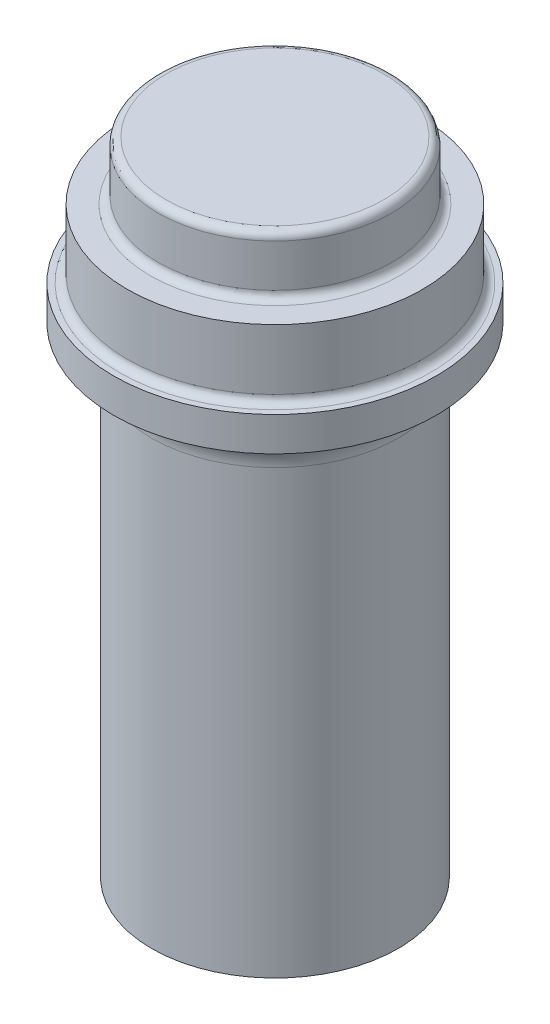
from build123d import *

# Parameters (mm, degrees)
SKETCH1_R           = 15.9
BOSS_EXTRUDE1_DEPTH = 62
SKETCH2_R           = 20.8
BOSS_EXTRUDE2_DEPTH = 4.4
SKETCH3_R           = 19.05
BOSS_EXTRUDE3_DEPTH = 8.8
SKETCH4_R           = 15.05
BOSS_EXTRUDE4_DEPTH = 7.5
FILLET1_R           = 5
FILLET2_R           = 1


with BuildPart() as part:
    # Sketch1 → Boss-Extrude1 (new body)
    with BuildSketch(Plane(origin=(0, 0, 0), x_dir=(1, 0, 0), z_dir=(0, 1, 0))):
        with Locations(Location((0, 0, 0), (0, 0, 270))):
            Circle(SKETCH1_R)
    extrude(amount=BOSS_EXTRUDE1_DEPTH)

    # Sketch2 → Boss-Extrude2 (add)
    with BuildSketch(Plane(origin=(0, 62, 0), x_dir=(1, 0, 0), z_dir=(0, 1, 0))):
        with Locations(Location((0, 0, 0), (0, 0, 270))):
            Circle(SKETCH2_R)
    extrude(amount=BOSS_EXTRUDE2_DEPTH)

    # Sketch3 → Boss-Extrude3 (add)
    with BuildSketch(Plane(origin=(0, 66.4, 0), x_dir=(1, 0, 0), z_dir=(0, 1, 0))):
        with Locations(Location((0, 0, 0), (0, 0, 270))):
            Circle(SKETCH3_R)
    extrude(amount=BOSS_EXTRUDE3_DEPTH)

    # Sketch4 → Boss-Extrude4 (add)
    with BuildSketch(Plane(origin=(0, 75.2, 0), x_dir=(1, 0, 0), z_dir=(0, 1, 0))):
        with Locations(Location((0, 0, 0), (0, 0, 270))):
            Circle(SKETCH4_R)
    extrude(amount=BOSS_EXTRUDE4_DEPTH)

    # Fillet1
    # the kernel refuses this fillet: 5 mm, written as the material it adds along each edge
    with BuildSketch(Plane(origin=(0, 62, 0), x_dir=(0, 0, 1), z_dir=(-1, 0, 0))) as fillet1_piece_1_section:
        with BuildLine():
            CenterArc((15.9 + FILLET1_R, -FILLET1_R), FILLET1_R, 90, 90)
            Line((15.9, -FILLET1_R), (15.9, 0))
            Line((15.9, 0), (15.9 + FILLET1_R, 0))
        make_face()
    fillet1_piece_1 = revolve(axis=Axis((0, 62, 0), (0, 1, 0)), mode=Mode.PRIVATE)
    fillet1_piece_1 = fillet1_piece_1 & Plane(origin=(0, 60.561583107, 0), x_dir=(0, 0, 1), z_dir=(0, -1, 0)) * Cylinder(20.8, 84, mode=Mode.PRIVATE)
    add(fillet1_piece_1)

    # Fillet2
    fillet2_edges = [part.edges().sort_by_distance(p)[0] for p in [
        (0, 75.2, -15.05),
        (0, 82.7, -15.05),
        (0, 66.4, -19.05),
    ]]
    fillet(fillet2_edges, radius=FILLET2_R)


solid = part.part
